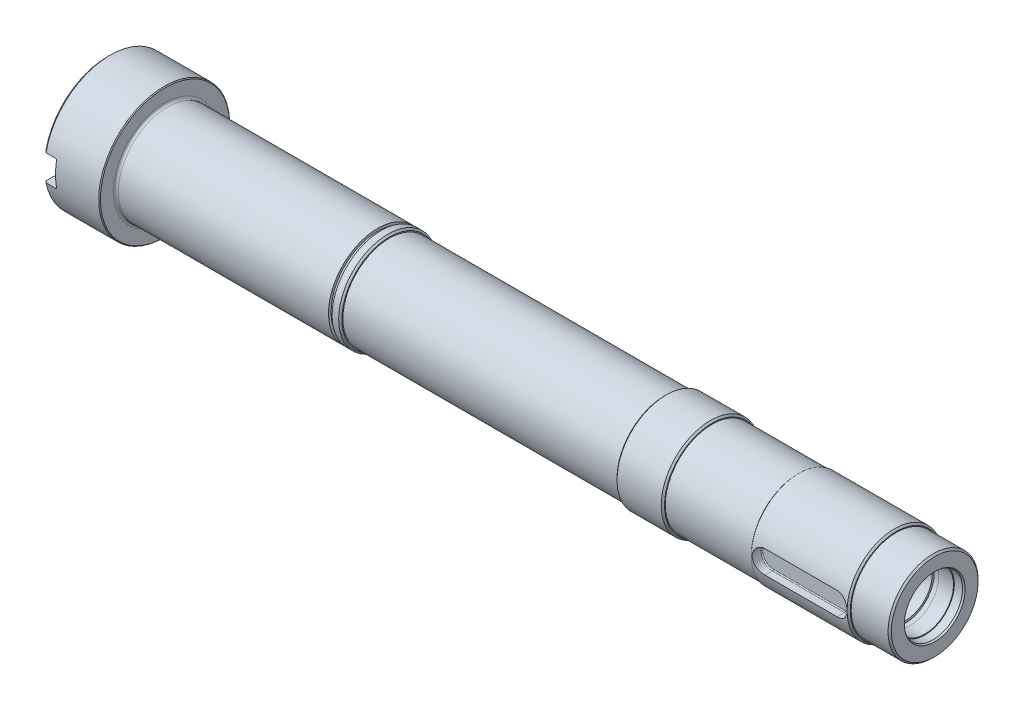
from build123d import *

# Parameters (mm, degrees)
SKETCH2_W                 = 8.1026
SKETCH2_H                 = 15.875
CUT_EXTRUDE1_DEPTH        = 509.158439859
FILLET1_R                 = 0.9
CHAMFER1_SIZE             = 0.5
CHAMFER2_SIZE             = 0.68
CHAMFER2_SIZE2            = 0.804519922
M6X1_0_TAPPED_HOLE3_D     = 5
M6X1_0_TAPPED_HOLE3_DEPTH = 14.986
M6X1_0_TAPPED_HOLE3_TIP   = 1.502151548
CUT_EXTRUDE2_DEPTH        = 511.484084003
FILLET9_R                 = 0.6
CHAMFER3_SIZE             = 1
FILLET11_R                = 1.5
CHAMFER4_SIZE             = 0.5
CHAMFER5_SIZE             = 1
CHAMFER6_SIZE             = 1
CHAMFER8_SIZE             = 1
CHAMFER9_SIZE             = 0.5


with BuildPart() as part:
    # Sketch1 → Revolve1 (revolve)
    with BuildSketch(Plane.XY, mode=Mode.PRIVATE) as revolve1_sk:
        Polygon((0, 38.5), (0, 22.225), (57.770884658, 13.8), (71.066827565, 20), (78.696152423, 20), (79.5, 17), (86.5, 17), (86.5, 17.25), (95.732693176, 17.25), (117, 13.5), (170, 13.5), (170, 12.7), (278.5, 12.7), (278.5, 16), (285.5, 16), (285.5, 16.5), (487, 16.5), (487, 17.75), (490, 17.75), (490, 17.5), (499, 17.5), (499, 18), (504, 18), (505, 18.577350269), (505, 27.5), (481.5, 27.5), (481.5, 29), (421.5, 29), (421.5, 28.5), (369, 28.5), (369, 30), (340, 30), (340, 28.4), (172, 28.4), (172, 30), (167, 30), (167, 28.4353), (164.8156, 28.4353), (164.8156, 30), (35, 30), (35, 40), (1.5, 40), align=None)
    revolve(revolve1_sk.sketch.rotate(Axis((-259.751915285, 0, 0), (1, 0, 0)), 90), axis=Axis((-259.751915285, 0, 0), (1, 0, 0)))

    # Sketch2 → Cut-Extrude1 (cut, through all)
    with BuildSketch(Plane.XY):
        with Locations((4.0513, 0)):
            Rectangle(SKETCH2_W, SKETCH2_H)
    extrude(amount=CUT_EXTRUDE1_DEPTH, mode=Mode.SUBTRACT)

    # Fillet1
    fillet1_edges = [part.edges().sort_by_distance(p)[0] for p in [
        (8.1026, -7.9375, 29.346744713),
        (8.1026, 7.9375, 29.346744713),
    ]]
    fillet(fillet1_edges, radius=FILLET1_R)

    # Chamfer1
    chamfer1_edges = [part.edges().sort_by_distance(p)[0] for p in [
        (0, -7.9375, 29.216069478),
        (0, 7.9375, 29.216069478),
    ]]
    chamfer(chamfer1_edges, length=CHAMFER1_SIZE)

    # Chamfer2
    chamfer2_edges = [part.edges().sort_by_distance(p)[0] for p in [
        (0, 0, -22.225),
    ]]
    chamfer2_side = [part.faces().sort_by_distance(p)[0] for p in [
        (0, 0, -23.307346581),
    ]]
    chamfer(chamfer2_edges, length=CHAMFER2_SIZE, length2=CHAMFER2_SIZE2, reference=chamfer2_side[0])

    # M6x1.0 Tapped Hole3
    with Locations(Plane.ZY.offset(-8.1026)):
        with Locations((33.15, 0)):
            Hole(M6X1_0_TAPPED_HOLE3_D / 2, depth=M6X1_0_TAPPED_HOLE3_DEPTH)
            with Locations((0, 0, -(M6X1_0_TAPPED_HOLE3_DEPTH + M6X1_0_TAPPED_HOLE3_TIP / 2))):  # 118° drill point
                Cone(0, M6X1_0_TAPPED_HOLE3_D / 2, M6X1_0_TAPPED_HOLE3_TIP, mode=Mode.SUBTRACT)

    # Sketch5 → Cut-Extrude2 (cut, through all)
    with BuildSketch(Plane.XY.offset(23)):
        with BuildLine():
            Line((429.5, 7), (473.5, 7))
            ThreePointArc((473.5, 7), (480.5, 0), (473.5, -7))
            Line((473.5, -7), (429.5, -7))
            ThreePointArc((429.5, -7), (422.5, 0), (429.5, 7))
        make_face()
    extrude(amount=CUT_EXTRUDE2_DEPTH, mode=Mode.SUBTRACT)

    # Fillet9
    fillet9_edges = [part.edges().sort_by_distance(p)[0] for p in [
        (422.5, 0, 23),
        (451.5, -7, 23),
        (480.5, 0, 23),
        (451.5, 7, 23),
    ]]
    fillet(fillet9_edges, radius=FILLET9_R)

    # Chamfer3
    chamfer3_edges = [part.edges().sort_by_distance(p)[0] for p in [
        (505, 0, -27.5),
    ]]
    chamfer(chamfer3_edges, length=CHAMFER3_SIZE)

    # Fillet11
    fillet11_edges = [part.edges().sort_by_distance(p)[0] for p in [
        (35, 0, -30),
    ]]
    fillet(fillet11_edges, radius=FILLET11_R)

    # Chamfer4
    chamfer4_edges = [part.edges().sort_by_distance(p)[0] for p in [
        (35, 0, -40),
    ]]
    chamfer(chamfer4_edges, length=CHAMFER4_SIZE)

    # Chamfer5
    chamfer5_edges = [part.edges().sort_by_distance(p)[0] for p in [
        (172, 0, -30),
    ]]
    chamfer(chamfer5_edges, length=CHAMFER5_SIZE)

    # Chamfer6
    chamfer6_edges = [part.edges().sort_by_distance(p)[0] for p in [
        (340, 0, -30),
        (369, 0, -30),
    ]]
    chamfer(chamfer6_edges, length=CHAMFER6_SIZE)

    # Chamfer8
    chamfer8_edges = [part.edges().sort_by_distance(p)[0] for p in [
        (481.5, 0, -29),
    ]]
    chamfer(chamfer8_edges, length=CHAMFER8_SIZE)

    # Chamfer9
    chamfer9_edges = [part.edges().sort_by_distance(p)[0] for p in [
        (421.5, 0, -29),
    ]]
    chamfer(chamfer9_edges, length=CHAMFER9_SIZE - 0.0001)  # a hair under: the kernel refuses the full size


solid = part.part
